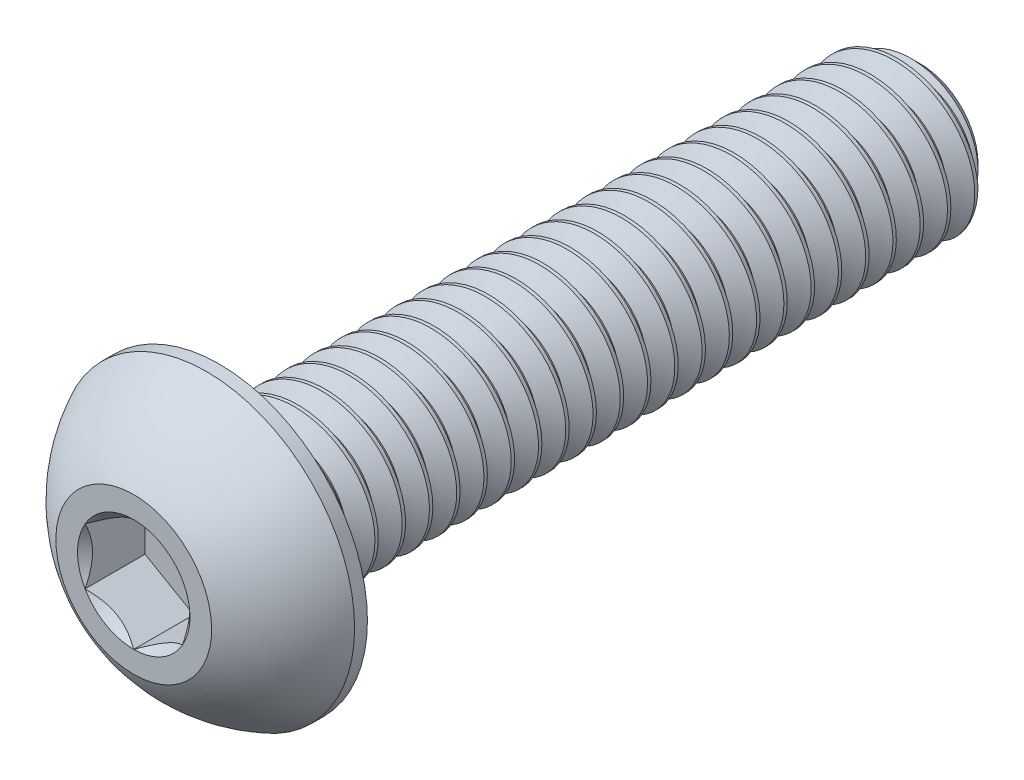
from build123d import *

# Parameters (mm, degrees)
CUT_EXTRUDE2_DEPTH = 1.54
CUT_SWEEP2_PITCH   = 0.7
CUT_SWEEP2_TO      = 18


with BuildPart() as part:
    # Sketch10 → Revolve3 (revolve)
    with BuildSketch(Plane(origin=(0, 0, 0), x_dir=(0, 0, -1), z_dir=(1, 0, 0)), mode=Mode.PRIVATE) as revolve3_sk:
        Polygon((19.675, 2), (20.2, 1.475), (20.2, 0), (2.2, 0), (2.2, 2), align=None)
    revolve(revolve3_sk.sketch.rotate(Axis((0, 0, 0), (0, 0, -1)), 90), axis=Axis((0, 0, 0), (0, 0, -1)))

    # Sketch7 → Revolve2 (revolve)
    with BuildSketch(Plane(origin=(0, 0, 0), x_dir=(0, 0, -1), z_dir=(1, 0, 0)), mode=Mode.PRIVATE) as revolve2_sk:
        with BuildLine():
            Line((1.87, 3.8), (2.2, 3.8))
            Line((2.2, 3.8), (2.2, 0))
            Line((2.2, 0), (0, 0))
            Line((0, 0), (0, 2))
            ThreePointArc((0, 2), (0.793500147, 3.047002626), (1.87, 3.8))
        make_face()
    revolve(revolve2_sk.sketch.rotate(Axis((0, 0, 0), (0, 0, -1)), 180), axis=Axis((0, 0, 0), (0, 0, -1)))

    # Sketch5 → Cut-Extrude2 (cut)
    with BuildSketch(Plane.XY):
        Polygon((1.25, -0.721687836), (1.25, 0.721687836), (0, 1.443375673), (-1.25, 0.721687836), (-1.25, -0.721687836), (0, -1.443375673), align=None)
    extrude(amount=-CUT_EXTRUDE2_DEPTH, mode=Mode.SUBTRACT)

    # Cut-Extrude3 cone 1 section (through the dimple's axis) → Cut-Extrude3 (revolve, cut)
    with BuildSketch(Plane(origin=(0, 0, 0), x_dir=(0, -1, 0), z_dir=(1, 0, 0))):
        Polygon((0, 0), (1.443375673, 0), (0, 1.443375673), align=None)
    revolve(axis=Axis((0, 0, 0), (0, 0, -1)), mode=Mode.SUBTRACT)


with BuildPart() as body_2:
    # Split1: read off the stored shape, not the designer's step
    # Split1: the piece on the far side of the plane
    add(part.part)
    split(bisect_by=Plane.XY.offset(-2.2), keep=Keep.BOTTOM)

    # Cut-Sweep2: arcs per turn and ends read off the stored shape
    # Cut-Sweep2: the profile of Sketch12 screwed along a right-hand helix through 30 turns, 6 arcs to a turn; built about Z, then put on its axis
    cut_sweep2_z = Axis((0, 0, 0), (0, 0, 1))
    cut_sweep2_corners = [(1.545336663, 0, -0.2625), (1.545336663, 0, -0.35), (2.037888611, 0, -0.634375), (2.037888611, 0, 0.021875)]
    with BuildLine(mode=Mode.PRIVATE) as cut_sweep2_profile:
        Line(cut_sweep2_corners[0], cut_sweep2_corners[1])
        Line(cut_sweep2_corners[1], cut_sweep2_corners[2])
        Line(cut_sweep2_corners[2], cut_sweep2_corners[3])
        Line(cut_sweep2_corners[3], cut_sweep2_corners[0])
    cut_sweep2_cap = Face(cut_sweep2_profile.wire())
    cut_sweep2_turn_angles = [0, 30, 60, 90, 120, 150, 180, 210, 240, 270, 300, 330, 360]
    cut_sweep2_turn_weights = [1, 0.8660254037844387, 1, 0.8660254037844387, 1, 0.8660254037844387, 1, 0.8660254037844387, 1, 0.8660254037844387, 1, 0.8660254037844387, 1]
    cut_sweep2_turn_rails = [Edge.make_bspline([Vector(p[0], p[1], 0).rotate(cut_sweep2_z, cut_sweep2_turn_angles[k]) / cut_sweep2_turn_weights[k] + Vector(0, 0, p[2] + CUT_SWEEP2_PITCH * cut_sweep2_turn_angles[k] / 360) for k in range(13)], [0, 0, 0, 1, 1, 2, 2, 3, 3, 4, 4, 5, 5, 6, 6, 6], 2, cut_sweep2_turn_weights) for p in cut_sweep2_corners]
    cut_sweep2_turn_sides = [Face.make_surface_from_curves(cut_sweep2_turn_rails[p[0]], cut_sweep2_turn_rails[p[1]]) for p in [(0, 1), (1, 2), (2, 3), (3, 0)]]
    cut_sweep2 = Plane(origin=(0, 0, -20.2), x_dir=(0, 1, 0), z_dir=(0, 0, 1)) * split(Solid(Shell([*[p.moved(Location((0, 0, CUT_SWEEP2_PITCH * i))) for i in range(30) for p in cut_sweep2_turn_sides], cut_sweep2_cap, cut_sweep2_cap.rotate(cut_sweep2_z, 10800).moved(Location((0, 0, CUT_SWEEP2_PITCH * 10800 / 360)))])), bisect_by=Plane.XY.offset(CUT_SWEEP2_TO), keep=Keep.BOTTOM, mode=Mode.PRIVATE)
    add(cut_sweep2, mode=Mode.SUBTRACT)


with BuildPart() as part_1:
    add(part.part)

    # Split1
    split(bisect_by=Plane.XY.offset(-2.2), keep=Keep.TOP)

    add(body_2.part)  # Boss-Extrude1 merges body 2
    # Boss-Extrude1: read off the stored shape, not the designer's step
    # Boss-Extrude1 outline → Boss-Extrude1 (revolve)
    with BuildSketch(Plane.XZ):
        Polygon((1.545336663, -2.2), (1.545336663, -2.654663337), (2, -2.2), align=None)
    revolve(axis=Axis((0, 0, 0), (0, 0, 1)))


solid = part_1.part
